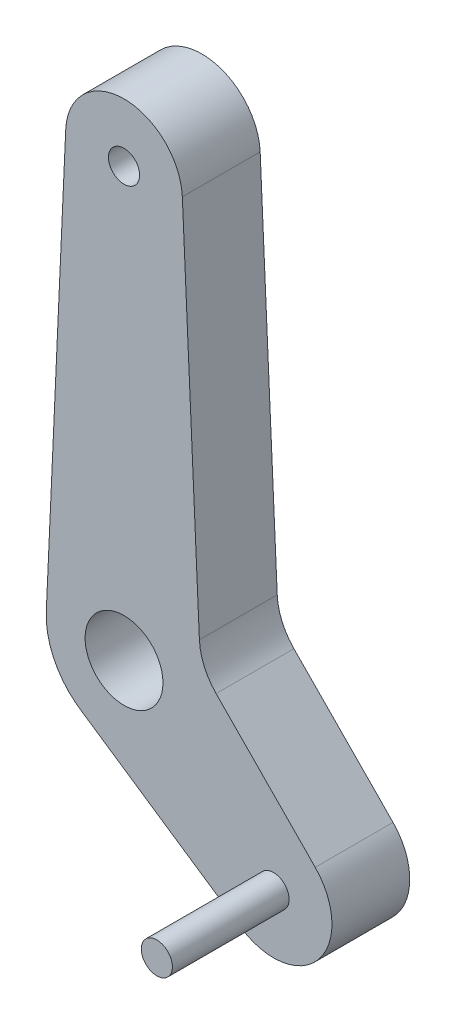
from build123d import *

# Parameters (mm, degrees)
SKETCH_1_R      = 10
SKETCH_1_R_2    = 4
EXTRUDE_1_DEPTH = 20
SKETCH_3_R      = 4
EXTRUDE_2_DEPTH = 30


with BuildPart() as part:
    # 草图1 → 凸台-拉伸1 (new body)
    with BuildSketch(Plane.XY):
        with BuildLine():
            Line((-14.98449612, 110.681818182), (-19.97932816, 0.909090909))
            ThreePointArc((-19.97932816, 0.909090909), (-17.697563903, -9.316449533), (-10.559228609, -16.985366972))
            Line((-10.559228609, -16.985366972), (30.032729917, -44.413973212))
            ThreePointArc((30.032729917, -44.413973212), (49.958811993, -41.582653696), (49.131368307, -21.473440532))
            Line((49.131368307, -21.473440532), (23.654514065, 4.460296303))
            ThreePointArc((23.654514065, 4.460296303), (20.60407219, 8.979454998), (19.370457306, 14.290404561))
            Line((19.370457306, 14.290404561), (14.98449612, 110.681818182))
            ThreePointArc((14.98449612, 110.681818182), (0, 125), (-14.98449612, 110.681818182))
        make_face()
        Circle(SKETCH_1_R, mode=Mode.SUBTRACT)
        with Locations((0, 110)):
            Circle(SKETCH_1_R_2, mode=Mode.SUBTRACT)
    extrude(amount=EXTRUDE_1_DEPTH)

    # 草图3 → 凸台-拉伸2 (add)
    with BuildSketch(Plane.XY.offset(20)):
        with Locations((38.430928946, -31.985366972)):
            Circle(SKETCH_3_R)
    extrude(amount=EXTRUDE_2_DEPTH)


solid = part.part
